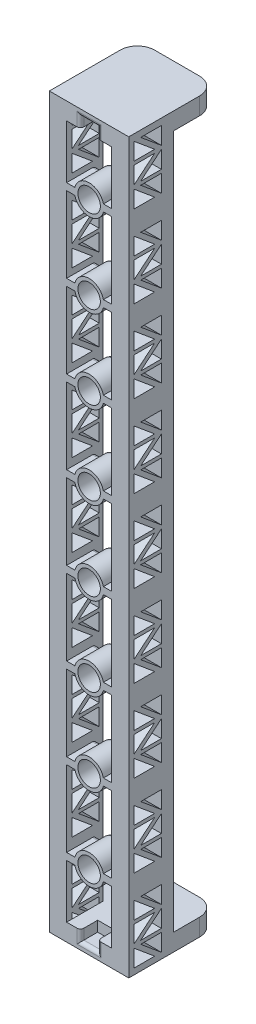
from build123d import *

# Parameters (mm, degrees)
SKETCH1_W              = 23
SKETCH1_H              = 211
SKETCH1_W_2            = 13
SKETCH1_H_2            = 201
BOSS_EXTRUDE1_DEPTH    = 13
SKETCH7_R              = 4.25
SKETCH7_R_2            = 3.25
SKETCH7_W              = 4
SKETCH7_H              = 2
BOSS_EXTRUDE5_DEPTH    = 8.5
FILLET4_R              = 1
LPATTERN7_COUNT        = 8
LPATTERN7_PITCH        = 24
FILLET4_OF_LPATTERN7_R = 1
SKETCH15_W             = 23
SKETCH15_H             = 13
BOSS_EXTRUDE8_DEPTH    = 5
CUT_EXTRUDE7_DEPTH     = 5
LPATTERN10_COUNT       = 9
LPATTERN10_PITCH       = 23.8
MIRROR7_COPY_1_DEPTH   = 5
MIRROR7_COPY_2_DEPTH   = 5
MIRROR7_COPY_3_DEPTH   = 5
MIRROR7_COPY_4_DEPTH   = 5
MIRROR7_COPY_5_DEPTH   = 5
MIRROR7_COPY_6_DEPTH   = 5
MIRROR7_COPY_7_DEPTH   = 5
MIRROR7_COPY_8_DEPTH   = 5
SKETCH22_W             = 23
SKETCH22_H             = 5
CUT_EXTRUDE9_DEPTH     = 112.854816615
SKETCH21_W             = 5
SKETCH21_H             = 3
CUT_EXTRUDE8_DEPTH     = 5
FILLET7_R              = 1
SKETCH23_W             = 23
SKETCH23_H             = 5
BOSS_EXTRUDE9_DEPTH    = 12.5
FILLET8_R              = 5
CUT_EXTRUDE11_START    = -5
CUT_EXTRUDE11_DEPTH    = 201


with BuildPart() as part:
    # Sketch1 → Boss-Extrude1 (new body)
    with BuildSketch(Plane.XY):
        Rectangle(SKETCH1_W, SKETCH1_H)
        Rectangle(SKETCH1_W_2, SKETCH1_H_2, mode=Mode.SUBTRACT)
    extrude(amount=BOSS_EXTRUDE1_DEPTH)

    # Sketch7 → Boss-Extrude5 (add)
    # profile 1 of 3: a face of its own
    with BuildSketch(Plane.XY.offset(13)):
        with Locations((0.023652706, 84)):
            Circle(SKETCH7_R)
        with Locations((0.023652706, 84)):
            Circle(SKETCH7_R_2, mode=Mode.SUBTRACT)
    # profile 2 of 3: a face of its own
    with BuildSketch(Plane.XY.offset(13)):
        with Locations((-5.395766476, 84)):
            Rectangle(SKETCH7_W, SKETCH7_H)
    # profile 3 of 3: a face of its own
    with BuildSketch(Plane.XY.offset(13)):
        with Locations((5.443071887, 84)):
            Rectangle(SKETCH7_W, SKETCH7_H)
    boss_extrude5 = extrude(amount=-BOSS_EXTRUDE5_DEPTH)

    # Fillet4
    fillet4_edges = [part.edges().sort_by_distance(p)[0] for p in [
        (-5.303512602, 83, 4.5),
        (5.327165308, 85, 4.5),
        (-5.303512602, 85, 4.5),
        (0.023652706, 88.25, 4.5),
        (5.327165308, 83, 4.5),
        (0.023652706, 79.75, 4.5),
    ]]
    fillet(fillet4_edges, radius=FILLET4_R - 0.0001)  # a hair under: the kernel refuses the full size

    # LPattern7: Boss-Extrude5 ×8
    with Locations(*[(0, -i * LPATTERN7_PITCH, 0) for i in range(1, LPATTERN7_COUNT)]):
        add(boss_extrude5)

    # Fillet4 of LPattern7
    fillet4_of_lpattern7_edges = [part.edges().sort_by_distance(p)[0] for p in [
        (-5.303512602, 59, 4.5),
        (5.327165308, 61, 4.5),
        (-5.303512602, 61, 4.5),
        (0.023652706, 64.25, 4.5),
        (5.327165308, 59, 4.5),
        (0.023652706, 55.75, 4.5),
        (-5.303512602, 35, 4.5),
        (5.327165308, 37, 4.5),
        (-5.303512602, 37, 4.5),
        (0.023652706, 40.25, 4.5),
        (5.327165308, 35, 4.5),
        (0.023652706, 31.75, 4.5),
        (-5.303512602, 11, 4.5),
        (5.327165308, 13, 4.5),
        (-5.303512602, 13, 4.5),
        (0.023652706, 16.25, 4.5),
        (5.327165308, 11, 4.5),
        (0.023652706, 7.75, 4.5),
        (-5.303512602, -13, 4.5),
        (5.327165308, -11, 4.5),
        (-5.303512602, -11, 4.5),
        (0.023652706, -7.75, 4.5),
        (5.327165308, -13, 4.5),
        (0.023652706, -16.25, 4.5),
        (-5.303512602, -37, 4.5),
        (5.327165308, -35, 4.5),
        (-5.303512602, -35, 4.5),
        (0.023652706, -31.75, 4.5),
        (5.327165308, -37, 4.5),
        (0.023652706, -40.25, 4.5),
        (-5.303512602, -61, 4.5),
        (5.327165308, -59, 4.5),
        (-5.303512602, -59, 4.5),
        (0.023652706, -55.75, 4.5),
        (5.327165308, -61, 4.5),
        (0.023652706, -64.25, 4.5),
        (-5.303512602, -85, 4.5),
        (5.327165308, -83, 4.5),
        (-5.303512602, -83, 4.5),
        (0.023652706, -79.75, 4.5),
        (5.327165308, -85, 4.5),
        (0.023652706, -88.25, 4.5),
    ]]
    fillet(fillet4_of_lpattern7_edges, radius=FILLET4_OF_LPATTERN7_R - 0.0001)  # a hair under: the kernel refuses the full size

    # Sketch15 → Boss-Extrude8 (add)
    with BuildSketch(Plane(origin=(0, 105.5, 0), x_dir=(1, 0, 0), z_dir=(0, 1, 0))):
        with Locations((0, -6.5)):
            Rectangle(SKETCH15_W, SKETCH15_H)
    boss_extrude8 = extrude(amount=BOSS_EXTRUDE8_DEPTH)

    # Mirror5: Boss-Extrude8 across plane
    add(boss_extrude8.mirror(Plane.ZX))

    # Sketch19 → Cut-Extrude7 (cut)
    with BuildSketch(Plane.ZY.offset(11.5)):
        Polygon((9.548485678, 103.625), (3.548485678, 103.625), (3.548485678, 98.625), align=None)
        Polygon((11.5, 103.625), (11.5, 98.625), (5.5, 98.625), align=None)
        Polygon((11.5, 97.625), (5.5, 97.625), (11.5, 92.625), align=None)
        Polygon((3.548485678, 92.625), (3.548485678, 97.625), (9.548485678, 92.625), align=None)
        Polygon((11.5, 91.625), (11.5, 86.625), (5.5, 86.625), align=None)
        Polygon((9.548485678, 91.625), (3.548485678, 91.625), (3.548485678, 86.625), align=None)
    cut_extrude7 = extrude(amount=-CUT_EXTRUDE7_DEPTH, mode=Mode.SUBTRACT)

    # LPattern10: Cut-Extrude7 ×9
    with Locations(*[(0, -i * LPATTERN10_PITCH, 0) for i in range(1, LPATTERN10_COUNT)]):
        add(cut_extrude7, mode=Mode.SUBTRACT)

    # Mirror7: Cut-Extrude7 across plane
    add(cut_extrude7.mirror(Plane.ZY), mode=Mode.SUBTRACT)

    # Mirror7 copy 1 sketch → Mirror7 copy 1 (cut)
    with BuildSketch(Plane(origin=(11.5, -23.8, 0), x_dir=(0, 0, 1), z_dir=(1, 0, 0))):
        Polygon((9.548485678, -103.625), (3.548485678, -103.625), (3.548485678, -98.625), align=None)
        Polygon((11.5, -103.625), (11.5, -98.625), (5.5, -98.625), align=None)
        Polygon((11.5, -97.625), (5.5, -97.625), (11.5, -92.625), align=None)
        Polygon((3.548485678, -92.625), (3.548485678, -97.625), (9.548485678, -92.625), align=None)
        Polygon((11.5, -91.625), (11.5, -86.625), (5.5, -86.625), align=None)
        Polygon((9.548485678, -91.625), (3.548485678, -91.625), (3.548485678, -86.625), align=None)
    extrude(amount=-MIRROR7_COPY_1_DEPTH, mode=Mode.SUBTRACT)

    # Mirror7 copy 2 sketch → Mirror7 copy 2 (cut)
    with BuildSketch(Plane(origin=(11.5, -47.6, 0), x_dir=(0, 0, 1), z_dir=(1, 0, 0))):
        Polygon((9.548485678, -103.625), (3.548485678, -103.625), (3.548485678, -98.625), align=None)
        Polygon((11.5, -103.625), (11.5, -98.625), (5.5, -98.625), align=None)
        Polygon((11.5, -97.625), (5.5, -97.625), (11.5, -92.625), align=None)
        Polygon((3.548485678, -92.625), (3.548485678, -97.625), (9.548485678, -92.625), align=None)
        Polygon((11.5, -91.625), (11.5, -86.625), (5.5, -86.625), align=None)
        Polygon((9.548485678, -91.625), (3.548485678, -91.625), (3.548485678, -86.625), align=None)
    extrude(amount=-MIRROR7_COPY_2_DEPTH, mode=Mode.SUBTRACT)

    # Mirror7 copy 3 sketch → Mirror7 copy 3 (cut)
    with BuildSketch(Plane(origin=(11.5, -71.4, 0), x_dir=(0, 0, 1), z_dir=(1, 0, 0))):
        Polygon((9.548485678, -103.625), (3.548485678, -103.625), (3.548485678, -98.625), align=None)
        Polygon((11.5, -103.625), (11.5, -98.625), (5.5, -98.625), align=None)
        Polygon((11.5, -97.625), (5.5, -97.625), (11.5, -92.625), align=None)
        Polygon((3.548485678, -92.625), (3.548485678, -97.625), (9.548485678, -92.625), align=None)
        Polygon((11.5, -91.625), (11.5, -86.625), (5.5, -86.625), align=None)
        Polygon((9.548485678, -91.625), (3.548485678, -91.625), (3.548485678, -86.625), align=None)
    extrude(amount=-MIRROR7_COPY_3_DEPTH, mode=Mode.SUBTRACT)

    # Mirror7 copy 4 sketch → Mirror7 copy 4 (cut)
    with BuildSketch(Plane(origin=(11.5, -95.2, 0), x_dir=(0, 0, 1), z_dir=(1, 0, 0))):
        Polygon((9.548485678, -103.625), (3.548485678, -103.625), (3.548485678, -98.625), align=None)
        Polygon((11.5, -103.625), (11.5, -98.625), (5.5, -98.625), align=None)
        Polygon((11.5, -97.625), (5.5, -97.625), (11.5, -92.625), align=None)
        Polygon((3.548485678, -92.625), (3.548485678, -97.625), (9.548485678, -92.625), align=None)
        Polygon((11.5, -91.625), (11.5, -86.625), (5.5, -86.625), align=None)
        Polygon((9.548485678, -91.625), (3.548485678, -91.625), (3.548485678, -86.625), align=None)
    extrude(amount=-MIRROR7_COPY_4_DEPTH, mode=Mode.SUBTRACT)

    # Mirror7 copy 5 sketch → Mirror7 copy 5 (cut)
    with BuildSketch(Plane(origin=(11.5, -119, 0), x_dir=(0, 0, 1), z_dir=(1, 0, 0))):
        Polygon((9.548485678, -103.625), (3.548485678, -103.625), (3.548485678, -98.625), align=None)
        Polygon((11.5, -103.625), (11.5, -98.625), (5.5, -98.625), align=None)
        Polygon((11.5, -97.625), (5.5, -97.625), (11.5, -92.625), align=None)
        Polygon((3.548485678, -92.625), (3.548485678, -97.625), (9.548485678, -92.625), align=None)
        Polygon((11.5, -91.625), (11.5, -86.625), (5.5, -86.625), align=None)
        Polygon((9.548485678, -91.625), (3.548485678, -91.625), (3.548485678, -86.625), align=None)
    extrude(amount=-MIRROR7_COPY_5_DEPTH, mode=Mode.SUBTRACT)

    # Mirror7 copy 6 sketch → Mirror7 copy 6 (cut)
    with BuildSketch(Plane(origin=(11.5, -142.8, 0), x_dir=(0, 0, 1), z_dir=(1, 0, 0))):
        Polygon((9.548485678, -103.625), (3.548485678, -103.625), (3.548485678, -98.625), align=None)
        Polygon((11.5, -103.625), (11.5, -98.625), (5.5, -98.625), align=None)
        Polygon((11.5, -97.625), (5.5, -97.625), (11.5, -92.625), align=None)
        Polygon((3.548485678, -92.625), (3.548485678, -97.625), (9.548485678, -92.625), align=None)
        Polygon((11.5, -91.625), (11.5, -86.625), (5.5, -86.625), align=None)
        Polygon((9.548485678, -91.625), (3.548485678, -91.625), (3.548485678, -86.625), align=None)
    extrude(amount=-MIRROR7_COPY_6_DEPTH, mode=Mode.SUBTRACT)

    # Mirror7 copy 7 sketch → Mirror7 copy 7 (cut)
    with BuildSketch(Plane(origin=(11.5, -166.6, 0), x_dir=(0, 0, 1), z_dir=(1, 0, 0))):
        Polygon((9.548485678, -103.625), (3.548485678, -103.625), (3.548485678, -98.625), align=None)
        Polygon((11.5, -103.625), (11.5, -98.625), (5.5, -98.625), align=None)
        Polygon((11.5, -97.625), (5.5, -97.625), (11.5, -92.625), align=None)
        Polygon((3.548485678, -92.625), (3.548485678, -97.625), (9.548485678, -92.625), align=None)
        Polygon((11.5, -91.625), (11.5, -86.625), (5.5, -86.625), align=None)
        Polygon((9.548485678, -91.625), (3.548485678, -91.625), (3.548485678, -86.625), align=None)
    extrude(amount=-MIRROR7_COPY_7_DEPTH, mode=Mode.SUBTRACT)

    # Mirror7 copy 8 sketch → Mirror7 copy 8 (cut)
    with BuildSketch(Plane(origin=(11.5, -190.4, 0), x_dir=(0, 0, 1), z_dir=(1, 0, 0))):
        Polygon((9.548485678, -103.625), (3.548485678, -103.625), (3.548485678, -98.625), align=None)
        Polygon((11.5, -103.625), (11.5, -98.625), (5.5, -98.625), align=None)
        Polygon((11.5, -97.625), (5.5, -97.625), (11.5, -92.625), align=None)
        Polygon((3.548485678, -92.625), (3.548485678, -97.625), (9.548485678, -92.625), align=None)
        Polygon((11.5, -91.625), (11.5, -86.625), (5.5, -86.625), align=None)
        Polygon((9.548485678, -91.625), (3.548485678, -91.625), (3.548485678, -86.625), align=None)
    extrude(amount=-MIRROR7_COPY_8_DEPTH, mode=Mode.SUBTRACT)

    # Sketch22 → Cut-Extrude9 (cut, through all)
    with BuildSketch(Plane(origin=(0, 0, 0), x_dir=(-1, 0, 0), z_dir=(0, 0, -1))):
        with Locations((0, 108)):
            Rectangle(SKETCH22_W, SKETCH22_H)
        with Locations((0, -108)):
            Rectangle(SKETCH22_W, SKETCH22_H)
    extrude(amount=-CUT_EXTRUDE9_DEPTH, mode=Mode.SUBTRACT)

    # Sketch21 → Cut-Extrude8 (cut)
    with BuildSketch(Plane.XY.offset(13)):
        with Locations((0, 102)):
            Rectangle(SKETCH21_W, SKETCH21_H)
        with Locations((0, -102)):
            Rectangle(SKETCH21_W, SKETCH21_H)
    extrude(amount=-CUT_EXTRUDE8_DEPTH, mode=Mode.SUBTRACT)

    # Fillet7
    fillet7_edges = [part.edges().sort_by_distance(p)[0] for p in [
        (-2.5, -102, 13),
        (0, -103.5, 13),
        (2.5, -102, 13),
        (-2.5, 102, 13),
        (2.5, 102, 13),
        (0, 103.5, 13),
    ]]
    fillet(fillet7_edges, radius=FILLET7_R)

    # Sketch23 → Boss-Extrude9 (add)
    with BuildSketch(Plane(origin=(0, 0, 0), x_dir=(-1, 0, 0), z_dir=(0, 0, -1))):
        with Locations((0, 103)):
            Rectangle(SKETCH23_W, SKETCH23_H)
        with Locations((0, -103)):
            Rectangle(SKETCH23_W, SKETCH23_H)
    extrude(amount=BOSS_EXTRUDE9_DEPTH)

    # Fillet8
    fillet8_edges = [part.edges().sort_by_distance(p)[0] for p in [
        (11.5, 103, -12.5),
        (-11.5, 103, -12.5),
        (11.5, -103, -12.5),
        (-11.5, -103, -12.5),
    ]]
    fillet(fillet8_edges, radius=FILLET8_R)

    # Sketch25 → Cut-Extrude11 (cut)
    with BuildSketch(Plane.XZ.offset(105.5).offset(CUT_EXTRUDE11_START)):
        with BuildLine():
            Line((-9, -0.5), (-6, -0.5))
            Line((-6, -0.5), (-6, 2.5))
            ThreePointArc((-6, 2.5), (-8.121320344, 1.621320344), (-9, -0.5))
        make_face()
        with BuildLine():
            Line((6, -0.5), (6, 2.5))
            ThreePointArc((6, 2.5), (8.121320344, 1.621320344), (9, -0.5))
            Line((9, -0.5), (6, -0.5))
        make_face()
    extrude(amount=-CUT_EXTRUDE11_DEPTH, mode=Mode.SUBTRACT)


solid = part.part
